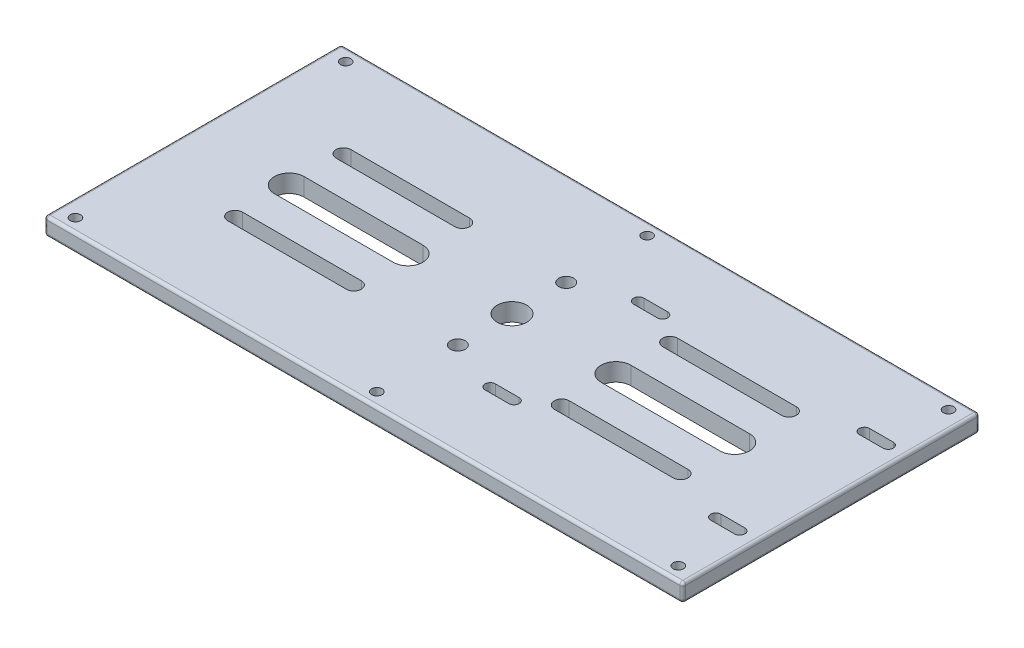
from build123d import *

# Parameters (mm, degrees)
SKETCH1_W           = 215
SKETCH1_H           = 100
SKETCH1_R           = 5
SKETCH1_R_2         = 2.5
SKETCH1_R_3         = 1.75
BOSS_EXTRUDE1_DEPTH = 6
FILLET1_R           = 1


with BuildPart() as part:
    # Sketch1 → Boss-Extrude1 (new body)
    with BuildSketch(Plane(origin=(0, 0, 0), x_dir=(1, 0, 0), z_dir=(0, 1, 0))):
        Rectangle(SKETCH1_W, SKETCH1_H)
        Circle(SKETCH1_R, mode=Mode.SUBTRACT)
        with Locations((0, 18.25)):
            Circle(SKETCH1_R_2, mode=Mode.SUBTRACT)
        with Locations((0, -18.25)):
            Circle(SKETCH1_R_2, mode=Mode.SUBTRACT)
        with Locations((101.5, 45.5)):
            Circle(SKETCH1_R_3, mode=Mode.SUBTRACT)
        with Locations((101.5, -45.5)):
            Circle(SKETCH1_R_3, mode=Mode.SUBTRACT)
        with Locations((-101.5, -45.5)):
            Circle(SKETCH1_R_3, mode=Mode.SUBTRACT)
        with Locations((-101.5, 45.5)):
            Circle(SKETCH1_R_3, mode=Mode.SUBTRACT)
        with Locations((0, 45.5)):
            Circle(SKETCH1_R_3, mode=Mode.SUBTRACT)
        with Locations((0, -45.5)):
            Circle(SKETCH1_R_3, mode=Mode.SUBTRACT)
        with BuildLine():
            Line((35, 5), (75, 5))
            ThreePointArc((75, 5), (80, 0), (75, -5))
            Line((75, -5), (35, -5))
            ThreePointArc((35, -5), (30, 0), (35, 5))
        make_face(mode=Mode.SUBTRACT)
        with BuildLine():
            Line((35, 15.75), (75, 15.75))
            ThreePointArc((75, 15.75), (77.5, 18.25), (75, 20.75))
            Line((75, 20.75), (35, 20.75))
            ThreePointArc((35, 20.75), (32.5, 18.25), (35, 15.75))
        make_face(mode=Mode.SUBTRACT)
        with BuildLine():
            Line((17.66, -23.25), (25.66, -23.25))
            ThreePointArc((25.66, -23.25), (27.41, -25), (25.66, -26.75))
            Line((25.66, -26.75), (17.66, -26.75))
            ThreePointArc((17.66, -26.75), (15.91, -25), (17.66, -23.25))
        make_face(mode=Mode.SUBTRACT)
        with BuildLine():
            Line((17.66, 26.75), (25.66, 26.75))
            ThreePointArc((25.66, 26.75), (27.41, 25), (25.66, 23.25))
            Line((25.66, 23.25), (17.66, 23.25))
            ThreePointArc((17.66, 23.25), (15.91, 25), (17.66, 26.75))
        make_face(mode=Mode.SUBTRACT)
        with BuildLine():
            Line((101.66, -23.25), (93.66, -23.25))
            ThreePointArc((93.66, -23.25), (91.91, -25), (93.66, -26.75))
            Line((93.66, -26.75), (101.66, -26.75))
            ThreePointArc((101.66, -26.75), (103.41, -25), (101.66, -23.25))
        make_face(mode=Mode.SUBTRACT)
        with BuildLine():
            Line((101.66, 23.25), (93.66, 23.25))
            ThreePointArc((93.66, 23.25), (91.91, 25), (93.66, 26.75))
            Line((93.66, 26.75), (101.66, 26.75))
            ThreePointArc((101.66, 26.75), (103.41, 25), (101.66, 23.25))
        make_face(mode=Mode.SUBTRACT)
        with BuildLine():
            Line((35, -15.75), (75, -15.75))
            ThreePointArc((75, -15.75), (77.5, -18.25), (75, -20.75))
            Line((75, -20.75), (35, -20.75))
            ThreePointArc((35, -20.75), (32.5, -18.25), (35, -15.75))
        make_face(mode=Mode.SUBTRACT)
        with BuildLine():
            Line((-35, 15.75), (-75, 15.75))
            ThreePointArc((-75, 15.75), (-77.5, 18.25), (-75, 20.75))
            Line((-75, 20.75), (-35, 20.75))
            ThreePointArc((-35, 20.75), (-32.5, 18.25), (-35, 15.75))
        make_face(mode=Mode.SUBTRACT)
        with BuildLine():
            Line((-35, -5), (-75, -5))
            ThreePointArc((-75, -5), (-80, 0), (-75, 5))
            Line((-75, 5), (-35, 5))
            ThreePointArc((-35, 5), (-30, 0), (-35, -5))
        make_face(mode=Mode.SUBTRACT)
        with BuildLine():
            Line((-35, -15.75), (-75, -15.75))
            ThreePointArc((-75, -15.75), (-77.5, -18.25), (-75, -20.75))
            Line((-75, -20.75), (-35, -20.75))
            ThreePointArc((-35, -20.75), (-32.5, -18.25), (-35, -15.75))
        make_face(mode=Mode.SUBTRACT)
    extrude(amount=BOSS_EXTRUDE1_DEPTH)

    # Fillet1
    fillet1_edges = [part.edges().sort_by_distance(p)[0] for p in [
        (0, 6, -50),
        (0, 0, -50),
        (-107.5, 3, -50),
        (-107.5, 6, 0),
        (-107.5, 0, 0),
        (-107.5, 3, 50),
        (0, 6, 50),
        (0, 0, 50),
        (107.5, 3, 50),
        (107.5, 6, 0),
        (107.5, 3, -50),
        (107.5, 0, 0),
    ]]
    fillet(fillet1_edges, radius=FILLET1_R)


solid = part.part
